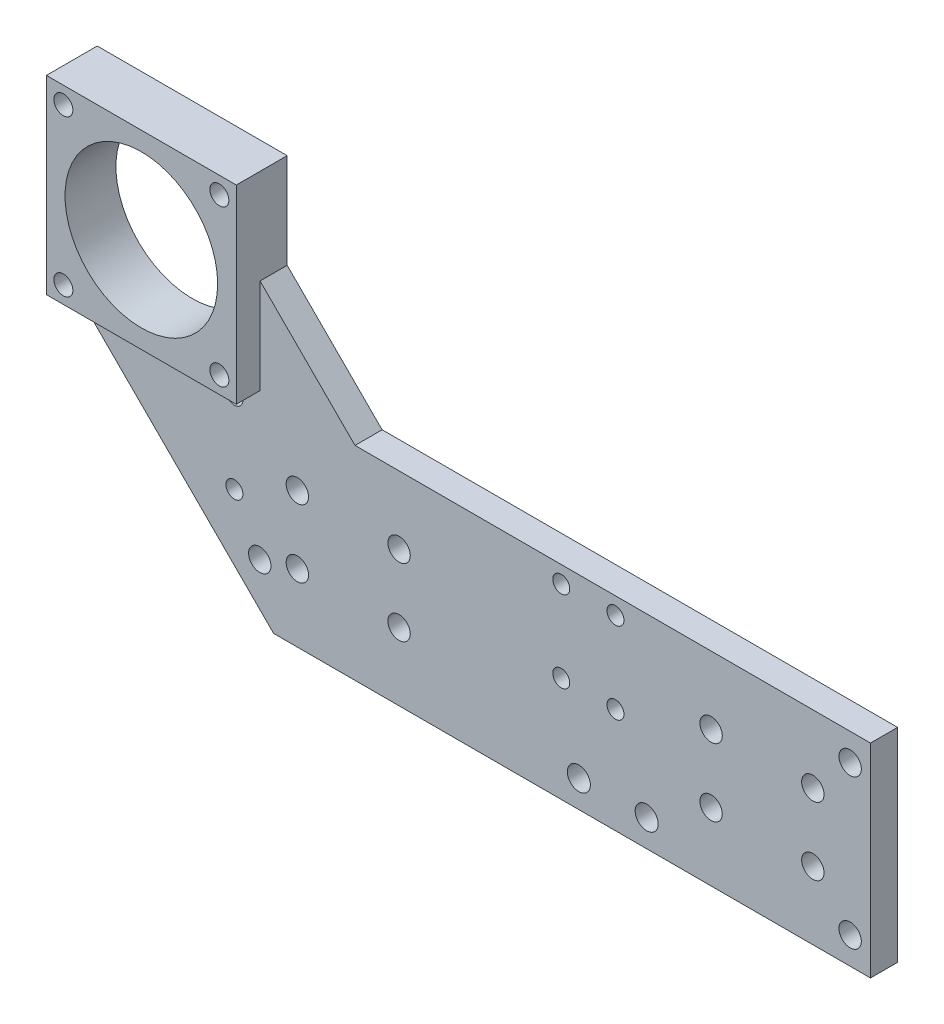
from build123d import *
from build123d.topology import SkipClean

# Parameters (mm, degrees)
SKETCH_1_W          = 112
SKETCH_1_H          = 58
EXTRUDE_1_DEPTH     = 4
SKETCH_2_OUTSIDE_W  = 139.238
SKETCH_2_OUTSIDE_H  = 85.238
CUT_EXTRUDE_1_DEPTH = 4
SKETCH_3_R          = 11.25
CUT_EXTRUDE_2_DEPTH = 4
CUT_EXTRUDE_3_REACH = 65.19
SKETCH_4_R          = 1.65
SKETCH_4_R_2        = 1.7
CUT_EXTRUDE_4_REACH = 65.19
SKETCH_5_R          = 1.25
SKETCH_8_W          = 6
SKETCH_8_H          = 30
EXTRUDE_3_DEPTH     = 4
CUT_EXTRUDE_5_REACH = 70.564
SKETCH_10_R         = 1.65
CUT_EXTRUDE_6_REACH = 70.564
SKETCH_11_R         = 1.65
SKETCH_13_R         = 1.4
CUT_EXTRUDE_7_DEPTH = 69.563838866
SKETCH_14_W         = 28
SKETCH_14_H         = 28
SKETCH_14_R         = 11.25
SKETCH_14_R_2       = 1.4
EXTRUDE_4_DEPTH     = 3.5


with BuildPart() as part:
    # 草图1 → 凸台-拉伸1 (new body)
    with BuildSketch(Plane.XY):
        Rectangle(SKETCH_1_W, SKETCH_1_H)
    extrude(amount=EXTRUDE_1_DEPTH)

    # 草图2 outside → 切除-拉伸1 (cut)
    with BuildSketch(Plane.XY.offset(4)):
        Rectangle(SKETCH_2_OUTSIDE_W, SKETCH_2_OUTSIDE_H)
        Polygon((56, 1), (-14, 1), (-28, 15), (-28, 29), (-56, 29), (-56, 1), (-26, -29), (56, -29), align=None, mode=Mode.SUBTRACT)
    extrude(amount=-CUT_EXTRUDE_1_DEPTH, mode=Mode.SUBTRACT)

    # 草图3 → 切除-拉伸2 (cut)
    with BuildSketch(Plane.XY.offset(4)):
        with Locations((-42, 15)):
            Circle(SKETCH_3_R)
    extrude(amount=-CUT_EXTRUDE_2_DEPTH, mode=Mode.SUBTRACT)

    # 草图4 → 切除-拉伸3 (cut, up to next)
    with BuildSketch(Plane.XY.offset(4), mode=Mode.PRIVATE) as cut_extrude_3_sk1:
        with Locations((-22.5, -19)):
            Circle(SKETCH_4_R)
    cut_extrude_3_tool1 = extrude(cut_extrude_3_sk1.sketch, amount=-CUT_EXTRUDE_3_REACH, mode=Mode.PRIVATE) & part.part
    # 草图4 → 切除-拉伸3 (cut, up to next)
    with BuildSketch(Plane.XY.offset(4), mode=Mode.PRIVATE) as cut_extrude_3_sk2:
        with Locations((-22.5, -9)):
            Circle(SKETCH_4_R)
    cut_extrude_3_tool2 = extrude(cut_extrude_3_sk2.sketch, amount=-CUT_EXTRUDE_3_REACH, mode=Mode.PRIVATE) & part.part
    # 草图4 → 切除-拉伸3 (cut, up to next)
    with BuildSketch(Plane.XY.offset(4), mode=Mode.PRIVATE) as cut_extrude_3_sk3:
        with Locations((-7.5, -19)):
            Circle(SKETCH_4_R)
    cut_extrude_3_tool3 = extrude(cut_extrude_3_sk3.sketch, amount=-CUT_EXTRUDE_3_REACH, mode=Mode.PRIVATE) & part.part
    # 草图4 → 切除-拉伸3 (cut, up to next)
    with BuildSketch(Plane.XY.offset(4), mode=Mode.PRIVATE) as cut_extrude_3_sk4:
        with Locations((-7.5, -9)):
            Circle(SKETCH_4_R)
    cut_extrude_3_tool4 = extrude(cut_extrude_3_sk4.sketch, amount=-CUT_EXTRUDE_3_REACH, mode=Mode.PRIVATE) & part.part
    # 草图4 → 切除-拉伸3 (cut, up to next)
    with BuildSketch(Plane.XY.offset(4), mode=Mode.PRIVATE) as cut_extrude_3_sk5:
        with Locations((38.5, -19)):
            Circle(SKETCH_4_R)
    cut_extrude_3_tool5 = extrude(cut_extrude_3_sk5.sketch, amount=-CUT_EXTRUDE_3_REACH, mode=Mode.PRIVATE) & part.part
    # 草图4 → 切除-拉伸3 (cut, up to next)
    with BuildSketch(Plane.XY.offset(4), mode=Mode.PRIVATE) as cut_extrude_3_sk6:
        with Locations((38.5, -9)):
            Circle(SKETCH_4_R)
    cut_extrude_3_tool6 = extrude(cut_extrude_3_sk6.sketch, amount=-CUT_EXTRUDE_3_REACH, mode=Mode.PRIVATE) & part.part
    # 草图4 → 切除-拉伸3 (cut, up to next)
    with BuildSketch(Plane.XY.offset(4), mode=Mode.PRIVATE) as cut_extrude_3_sk7:
        with Locations((53.5, -19)):
            Circle(SKETCH_4_R)
    cut_extrude_3_tool7 = extrude(cut_extrude_3_sk7.sketch, amount=-CUT_EXTRUDE_3_REACH, mode=Mode.PRIVATE) & part.part
    # 草图4 → 切除-拉伸3 (cut, up to next)
    with BuildSketch(Plane.XY.offset(4), mode=Mode.PRIVATE) as cut_extrude_3_sk8:
        with Locations((53.5, -9)):
            Circle(SKETCH_4_R)
    cut_extrude_3_tool8 = extrude(cut_extrude_3_sk8.sketch, amount=-CUT_EXTRUDE_3_REACH, mode=Mode.PRIVATE) & part.part
    # 草图4 → 切除-拉伸3 (cut, up to next)
    with BuildSketch(Plane.XY.offset(4), mode=Mode.PRIVATE) as cut_extrude_3_sk9:
        with Locations((19, -25)):
            Circle(SKETCH_4_R_2)
    cut_extrude_3_tool9 = extrude(cut_extrude_3_sk9.sketch, amount=-CUT_EXTRUDE_3_REACH, mode=Mode.PRIVATE) & part.part
    # 草图4 → 切除-拉伸3 (cut, up to next)
    with BuildSketch(Plane.XY.offset(4), mode=Mode.PRIVATE) as cut_extrude_3_sk10:
        with Locations((29, -25)):
            Circle(SKETCH_4_R_2)
    cut_extrude_3_tool10 = extrude(cut_extrude_3_sk10.sketch, amount=-CUT_EXTRUDE_3_REACH, mode=Mode.PRIVATE) & part.part
    add(cut_extrude_3_tool1.solids().sort_by_distance((-22.5, -19, 4))[0], mode=Mode.SUBTRACT)
    add(cut_extrude_3_tool2.solids().sort_by_distance((-22.5, -9, 4))[0], mode=Mode.SUBTRACT)
    add(cut_extrude_3_tool3.solids().sort_by_distance((-7.5, -19, 4))[0], mode=Mode.SUBTRACT)
    add(cut_extrude_3_tool4.solids().sort_by_distance((-7.5, -9, 4))[0], mode=Mode.SUBTRACT)
    add(cut_extrude_3_tool5.solids().sort_by_distance((38.5, -19, 4))[0], mode=Mode.SUBTRACT)
    add(cut_extrude_3_tool6.solids().sort_by_distance((38.5, -9, 4))[0], mode=Mode.SUBTRACT)
    add(cut_extrude_3_tool7.solids().sort_by_distance((53.5, -19, 4))[0], mode=Mode.SUBTRACT)
    add(cut_extrude_3_tool8.solids().sort_by_distance((53.5, -9, 4))[0], mode=Mode.SUBTRACT)
    add(cut_extrude_3_tool9.solids().sort_by_distance((19, -25, 4))[0], mode=Mode.SUBTRACT)
    add(cut_extrude_3_tool10.solids().sort_by_distance((29, -25, 4))[0], mode=Mode.SUBTRACT)

    # 草图5 → 切除-拉伸4 (cut, up to next)
    with BuildSketch(Plane(origin=(0, 0, 0), x_dir=(-1, 0, 0), z_dir=(0, 0, -1)), mode=Mode.PRIVATE) as cut_extrude_4_sk1:
        with Locations((-16.406007896, -13.5)):
            Circle(SKETCH_5_R)
    cut_extrude_4_tool1 = extrude(cut_extrude_4_sk1.sketch, amount=-CUT_EXTRUDE_4_REACH, mode=Mode.PRIVATE) & part.part
    # 草图5 → 切除-拉伸4 (cut, up to next)
    with BuildSketch(Plane(origin=(0, 0, 0), x_dir=(-1, 0, 0), z_dir=(0, 0, -1)), mode=Mode.PRIVATE) as cut_extrude_4_sk2:
        with Locations((-24.406007896, -13.5)):
            Circle(SKETCH_5_R)
    cut_extrude_4_tool2 = extrude(cut_extrude_4_sk2.sketch, amount=-CUT_EXTRUDE_4_REACH, mode=Mode.PRIVATE) & part.part
    # 草图5 → 切除-拉伸4 (cut, up to next)
    with BuildSketch(Plane(origin=(0, 0, 0), x_dir=(-1, 0, 0), z_dir=(0, 0, -1)), mode=Mode.PRIVATE) as cut_extrude_4_sk3:
        with Locations((-16.406007896, -1.5)):
            Circle(SKETCH_5_R)
    cut_extrude_4_tool3 = extrude(cut_extrude_4_sk3.sketch, amount=-CUT_EXTRUDE_4_REACH, mode=Mode.PRIVATE) & part.part
    # 草图5 → 切除-拉伸4 (cut, up to next)
    with BuildSketch(Plane(origin=(0, 0, 0), x_dir=(-1, 0, 0), z_dir=(0, 0, -1)), mode=Mode.PRIVATE) as cut_extrude_4_sk4:
        with Locations((-24.406007896, -1.5)):
            Circle(SKETCH_5_R)
    cut_extrude_4_tool4 = extrude(cut_extrude_4_sk4.sketch, amount=-CUT_EXTRUDE_4_REACH, mode=Mode.PRIVATE) & part.part
    # 草图5 → 切除-拉伸4 (cut, up to next)
    with BuildSketch(Plane(origin=(0, 0, 0), x_dir=(-1, 0, 0), z_dir=(0, 0, -1)), mode=Mode.PRIVATE) as cut_extrude_4_sk5:
        with Locations((31.779946847, -13.5)):
            Circle(SKETCH_5_R)
    cut_extrude_4_tool5 = extrude(cut_extrude_4_sk5.sketch, amount=-CUT_EXTRUDE_4_REACH, mode=Mode.PRIVATE) & part.part
    # 草图5 → 切除-拉伸4 (cut, up to next)
    with BuildSketch(Plane(origin=(0, 0, 0), x_dir=(-1, 0, 0), z_dir=(0, 0, -1)), mode=Mode.PRIVATE) as cut_extrude_4_sk6:
        with Locations((31.779946847, -1.5)):
            Circle(SKETCH_5_R)
    cut_extrude_4_tool6 = extrude(cut_extrude_4_sk6.sketch, amount=-CUT_EXTRUDE_4_REACH, mode=Mode.PRIVATE) & part.part
    add(cut_extrude_4_tool1.solids().sort_by_distance((16.406008, -13.5, 0))[0], mode=Mode.SUBTRACT)
    add(cut_extrude_4_tool2.solids().sort_by_distance((24.406008, -13.5, 0))[0], mode=Mode.SUBTRACT)
    add(cut_extrude_4_tool3.solids().sort_by_distance((16.406008, -1.5, 0))[0], mode=Mode.SUBTRACT)
    add(cut_extrude_4_tool4.solids().sort_by_distance((24.406008, -1.5, 0))[0], mode=Mode.SUBTRACT)
    add(cut_extrude_4_tool5.solids().sort_by_distance((-31.779947, -13.5, 0))[0], mode=Mode.SUBTRACT)
    add(cut_extrude_4_tool6.solids().sort_by_distance((-31.779947, -1.5, 0))[0], mode=Mode.SUBTRACT)

    # 草图8 → 凸台-拉伸3 (add)
    with BuildSketch(Plane(origin=(0, 0, 0), x_dir=(-1, 0, 0), z_dir=(0, 0, -1))):
        with Locations((-59, -14)):
            Rectangle(SKETCH_8_W, SKETCH_8_H)
    extrude(amount=-EXTRUDE_3_DEPTH)

    # 草图10 → 切除-拉伸5 (cut, up to next)
    with BuildSketch(Plane.XY.offset(4), mode=Mode.PRIVATE) as cut_extrude_5_sk1:
        with Locations((59, -25)):
            Circle(SKETCH_10_R)
    cut_extrude_5_tool1 = extrude(cut_extrude_5_sk1.sketch, amount=-CUT_EXTRUDE_5_REACH, mode=Mode.PRIVATE) & part.part
    # 草图10 → 切除-拉伸5 (cut, up to next)
    with BuildSketch(Plane.XY.offset(4), mode=Mode.PRIVATE) as cut_extrude_5_sk2:
        with Locations((59, -3)):
            Circle(SKETCH_10_R)
    cut_extrude_5_tool2 = extrude(cut_extrude_5_sk2.sketch, amount=-CUT_EXTRUDE_5_REACH, mode=Mode.PRIVATE) & part.part
    add(cut_extrude_5_tool1.solids().sort_by_distance((59, -25, 4))[0], mode=Mode.SUBTRACT)
    add(cut_extrude_5_tool2.solids().sort_by_distance((59, -3, 4))[0], mode=Mode.SUBTRACT)

    # 草图11 → 切除-拉伸6 (cut, up to next)
    with BuildSketch(Plane.XY.offset(4), mode=Mode.PRIVATE) as cut_extrude_6_sk1:
        with Locations((-28.036589911, -20.593670707)):
            Circle(SKETCH_11_R)
    cut_extrude_6_tool1 = extrude(cut_extrude_6_sk1.sketch, amount=-CUT_EXTRUDE_6_REACH, mode=Mode.PRIVATE) & part.part
    add(cut_extrude_6_tool1.solids().sort_by_distance((-28.03659, -20.593671, 4))[0], mode=Mode.SUBTRACT)

    # 草图13 → 切除-拉伸7 (cut, through all)
    with BuildSketch(Plane(origin=(0, 0, 0), x_dir=(-1, 0, 0), z_dir=(0, 0, -1))):
        with Locations((53.5, 26.5)):
            Circle(SKETCH_13_R)
        with Locations((53.5, 3.5)):
            Circle(SKETCH_13_R)
        with Locations((30.5, 3.5)):
            Circle(SKETCH_13_R)
        with Locations((30.5, 26.5)):
            Circle(SKETCH_13_R)
    extrude(amount=-CUT_EXTRUDE_7_DEPTH, mode=Mode.SUBTRACT)

    # 草图14 → 凸台-拉伸4 (add)
    with SkipClean():  # the faces are left unmerged after this step: merging them gives an invalid solid
        with BuildSketch(Plane.XY.offset(4)):
            with Locations((-42, 15)):
                Rectangle(SKETCH_14_W, SKETCH_14_H)
            with Locations((-42, 15)):
                Circle(SKETCH_14_R, mode=Mode.SUBTRACT)
            with Locations((-30.5, 26.5)):
                Circle(SKETCH_14_R_2, mode=Mode.SUBTRACT)
            with Locations((-53.5, 26.5)):
                Circle(SKETCH_14_R_2, mode=Mode.SUBTRACT)
            with Locations((-53.5, 3.5)):
                Circle(SKETCH_14_R_2, mode=Mode.SUBTRACT)
            with Locations((-30.5, 3.5)):
                Circle(SKETCH_14_R_2, mode=Mode.SUBTRACT)
        extrude(amount=EXTRUDE_4_DEPTH)


solid = part.part
